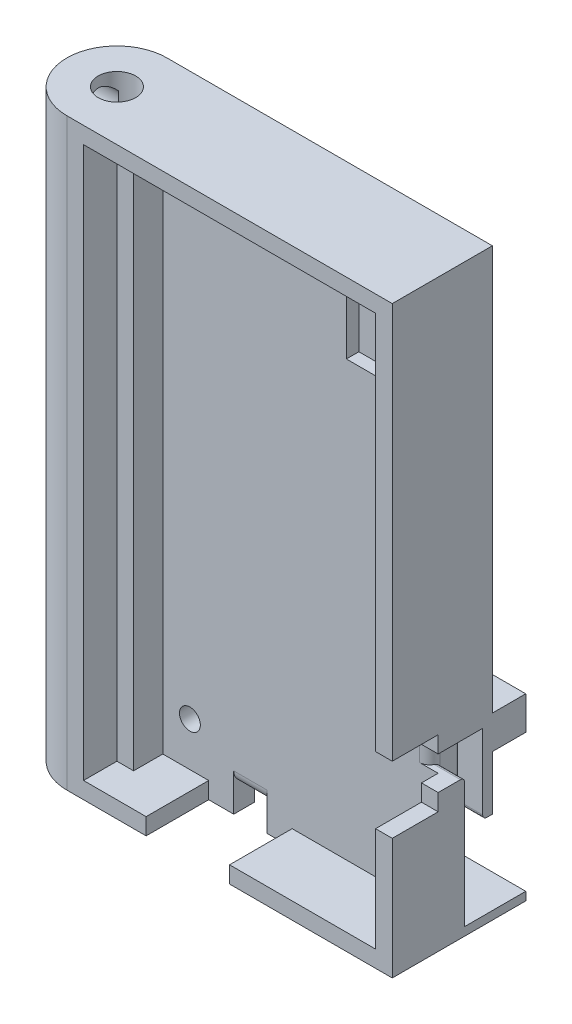
from build123d import *

# Parameters (mm, degrees)
SKETCH1_W                = 39
SKETCH1_H                = 70
BASE_DEPTH               = 4.5
SKETCH2_W                = 4
SKETCH2_H                = 62
WALLS_DEPTH              = 7.5
SKETCH3_W                = 10
SKETCH3_H                = 7.5
PWR_CONNECTOR_HOLE_DEPTH = 4
SKETCH4_W                = 7.5
SKETCH4_H                = 8
GPS_CONNECTOR_HOLE_DEPTH = 4
SKETCH5_R                = 1.25
MOUNTING_HOLES_DEPTH     = 4
GPS_MOUNT_DEPTH          = 4
SKETCH11_W               = 17
SKETCH11_H               = 1
SKETCH11_W_2             = 12
SKETCH11_H_2             = 3
PWR_CABLE_HOLDER1_DEPTH  = 4
SKETCH12_W               = 4
SKETCH12_H               = 2.5
PWR_CABLE_HOLDER2_DEPTH  = 3
PWR_FILLET_R             = 1.5
PWR_FILLET2_R            = 1
PWR_FILLET3_R            = 0.5
GPS_CABLE_HOLDER_DEPTH   = 3
GPS_START                = 1
GPS_FILLET_DEPTH         = 10
GPS_START_2              = 16.5
GPS_FILLET_2_DEPTH       = 4
GPS_START_3              = 9.15727
GPS_FILLET_3_DEPTH       = 8.34273
GPS_FILLET_2_2_R         = 0.5
SKETCH15_R               = 6
BALLON_MOUNT_DEPTH       = 70
SKETCH16_R               = 2.25
BALLOON_MOUNT_HOLE_DEPTH = 70
SKETCH21_R               = 2.25
SAFETY_MOUNT_DEPTH       = 4.5
SKETCH22_W               = 35
SKETCH22_H               = 66
LID_HOLE_DEPTH           = 7.5
SKETCH25_W               = 3.5
SKETCH25_H               = 66
CORRECTION_DEPTH         = 2
SKETCH28_W               = 2
SKETCH28_H               = 2
SMALLER_WALLS_DEPTH      = 2
SKETCH29_W               = 11
SKETCH29_H               = 14
ANTENNA_SPACE_DEPTH      = 1.5


with BuildPart() as part:
    # Sketch1 → Base (new body)
    with BuildSketch(Plane.XY):
        with Locations((19.5, 35)):
            Rectangle(SKETCH1_W, SKETCH1_H)
    extrude(amount=BASE_DEPTH)

    # Sketch2 → Walls (add)
    with BuildSketch(Plane.XY.offset(4.5)):
        Polygon((39, 66), (39, 70), (0, 70), (0, 66), (4, 66), (35, 66), align=None)
        with Locations((37, 35)):
            Rectangle(SKETCH2_W, SKETCH2_H)
        Polygon((4, 66), (0, 66), (0, 0), (4, 0), (4, 4), align=None)
        Polygon((39, 0), (39, 4), (35, 4), (4, 4), (4, 0), align=None)
    extrude(amount=WALLS_DEPTH)

    # Sketch3 → PWR connector hole (cut)
    with BuildSketch(Plane(origin=(0, 4, 0), x_dir=(1, 0, 0), z_dir=(0, 1, 0))):
        with Locations((14.5, -8.25)):
            Rectangle(SKETCH3_W, SKETCH3_H)
    extrude(amount=-PWR_CONNECTOR_HOLE_DEPTH, mode=Mode.SUBTRACT)

    # Sketch4 → GPS connector hole (cut)
    with BuildSketch(Plane.ZY.offset(-35)):
        with Locations((8.25, 18.5)):
            Rectangle(SKETCH4_W, SKETCH4_H)
    extrude(amount=-GPS_CONNECTOR_HOLE_DEPTH, mode=Mode.SUBTRACT)

    # Sketch5 → Mounting holes (cut)
    with BuildSketch(Plane.XY.offset(4.5)):
        with Locations((7.25, 7.25)):
            Circle(SKETCH5_R)
        with Locations(Location((31.75, 7.25, 0), (0, 0, 180))):
            Circle(SKETCH5_R)
        with Locations(Location((7.25, 62.75, 0), (0, 0, 180))):
            Circle(SKETCH5_R)
    extrude(amount=-MOUNTING_HOLES_DEPTH, mode=Mode.SUBTRACT)

    # Sketch7 → GPS mount (add)
    with BuildSketch(Plane(origin=(0, 0, 0), x_dir=(-1, 0, 0), z_dir=(0, 0, -1))):
        Polygon((-39, 1), (-39, 0), (-7, 0), (-7, 18.5), (-39, 18.5), (-39, 17.5), (-8, 17.5), (-8, 1), align=None)
    extrude(amount=GPS_MOUNT_DEPTH)

    # Sketch11 → PWR cable holder1 (add)
    with BuildSketch(Plane(origin=(0, 0, 0), x_dir=(-1, 0, 0), z_dir=(0, 0, -1))):
        Polygon((-5, 0), (-4, 0), (-4, 21.5), (-5, 21.5), (-5, 20.5), align=None)
        with Locations((-13.5, 21)):
            Rectangle(SKETCH11_W, SKETCH11_H)
        with Locations((-33, 20)):
            Rectangle(SKETCH11_W_2, SKETCH11_H_2)
    extrude(amount=PWR_CABLE_HOLDER1_DEPTH)

    # Sketch12 → PWR cable holder2 (cut)
    with BuildSketch(Plane.XZ):
        Polygon((5, 2), (5, 0), (7, 0), (16.5, 0), (16.5, 2), (12.5, 2), align=None)
        with Locations((14.5, 3.25)):
            Rectangle(SKETCH12_W, SKETCH12_H)
    extrude(amount=-PWR_CABLE_HOLDER2_DEPTH, mode=Mode.SUBTRACT)

    # PWR fillet
    pwr_fillet_edges = [part.edges().sort_by_distance(p)[0] for p in [
        (6, 3, 0),
        (14.5, 3, 4.5),
    ]]
    fillet(pwr_fillet_edges, radius=PWR_FILLET_R)

    # PWR fillet2
    pwr_fillet2_edges = [part.edges().sort_by_distance(p)[0] for p in [
        (27, 21.5, -2),
    ]]
    fillet(pwr_fillet2_edges, radius=PWR_FILLET2_R)

    # PWR fillet3
    pwr_fillet3_edges = [part.edges().sort_by_distance(p)[0] for p in [
        (22, 21.5, -2),
        (22, 20.5, -2),
    ]]
    fillet(pwr_fillet3_edges, radius=PWR_FILLET3_R - 0.0001)  # a hair under: the kernel refuses the full size

    # Sketch13 → GPS cable holder (cut)
    with BuildSketch(Plane(origin=(39, 0, 0), x_dir=(0, 0, -1), z_dir=(1, 0, 0))):
        Polygon((-1.156586719, 11), (-2.326586719, 11), (-2.326586719, 1), (0, 1), (0, 11), align=None)
        Polygon((-2.326586719, 11), (-2.326586719, 16.5), (-3.326586719, 16.5), (-3.326586719, 1), (-2.326586719, 1), align=None)
        Polygon((-1.156586719, 20.5), (-2.326586719, 20.5), (-2.326586719, 16.5), (-2.326586719, 11), (-1.156586719, 11), align=None)
        Polygon((-2.326586719, 20.5), (-4.5, 20.5), (-4.5, 16.5), (-3.326586719, 16.5), (-2.326586719, 16.5), align=None)
    extrude(amount=-GPS_CABLE_HOLDER_DEPTH, mode=Mode.SUBTRACT)

    # GPS fillet: read off the stored shape, not the designer's step
    # GPS fillet outline → GPS fillet (cut)
    with BuildSketch(Plane(origin=(0, 0, 0), x_dir=(1, 0, 0), z_dir=(0, 1, 0)).offset(GPS_START)):
        with BuildLine():
            Line((36, -3.326586719), (36, -3.25))
            ThreePointArc((36, -3.25), (35.999412758, -3.288311358), (35.997651584, -3.326586719))
            Line((35.997651584, -3.326586719), (36, -3.326586719))
        make_face()
        with BuildLine():
            Line((36, -1.25), (36, 0))
            Line((36, 0), (34.75, 0))
            ThreePointArc((34.75, 0), (35.633883476, -0.366116524), (36, -1.25))
        make_face()
    extrude(amount=GPS_FILLET_DEPTH, mode=Mode.SUBTRACT)

    # GPS fillet 2 outline → GPS fillet 2 (cut)
    with BuildSketch(Plane(origin=(0, 0, 0), x_dir=(1, 0, 0), z_dir=(0, 1, 0)).offset(GPS_START_2)):
        with BuildLine():
            ThreePointArc((36, -3.25), (35.633883476, -4.133883476), (34.75, -4.5))
            Line((34.75, -4.5), (36, -4.5))
            Line((36, -4.5), (36, -3.25))
        make_face()
        with BuildLine():
            ThreePointArc((35.996504697, -1.156586719), (35.999125868, -1.203260674), (36, -1.25))
            Line((36, -1.25), (36, -1.156586719))
            Line((36, -1.156586719), (35.996504697, -1.156586719))
        make_face()
    extrude(amount=GPS_FILLET_2_DEPTH, mode=Mode.SUBTRACT)

    # GPS fillet 3 outline → GPS fillet 3 (cut)
    with BuildSketch(Plane(origin=(0, 0, 0), x_dir=(1, 0, 0), z_dir=(0, 1, 0)).offset(GPS_START_3)):
        with BuildLine():
            Line((36, -3.326586719), (36, -3.25))
            ThreePointArc((36, -3.25), (35.999412758, -3.288311358), (35.997651584, -3.326586719))
            Line((35.997651584, -3.326586719), (36, -3.326586719))
        make_face()
        with BuildLine():
            ThreePointArc((35.996504697, -1.156586719), (35.999125868, -1.203260674), (36, -1.25))
            Line((36, -1.25), (36, -1.156586719))
            Line((36, -1.156586719), (35.996504697, -1.156586719))
        make_face()
    extrude(amount=GPS_FILLET_3_DEPTH, mode=Mode.SUBTRACT)

    # GPS fillet 2 2
    # the kernel refuses this fillet: 0.5 mm, written as the material it takes off along each edge
    with BuildSketch(Plane(origin=(40.25, 11, 1.156586719), x_dir=(0, 0, -1), z_dir=(-1, 0, 0))) as gps_fillet_2_2_piece_1:
        with BuildLine():
            CenterArc((GPS_FILLET_2_2_R, -GPS_FILLET_2_2_R), GPS_FILLET_2_2_R, 90, 90)
            Line((0, -GPS_FILLET_2_2_R), (0, 0))
            Line((0, 0), (GPS_FILLET_2_2_R, 0))
        make_face()
    extrude(amount=4.25, mode=Mode.SUBTRACT)
    with BuildSketch(Plane(origin=(40.25, 16.5, 3.326586719), x_dir=(0, -1, 0), z_dir=(-1, 0, 0))) as gps_fillet_2_2_piece_2:
        with BuildLine():
            CenterArc((GPS_FILLET_2_2_R, GPS_FILLET_2_2_R), GPS_FILLET_2_2_R, 180, 90)
            Line((0, GPS_FILLET_2_2_R), (0, 0))
            Line((0, 0), (GPS_FILLET_2_2_R, 0))
        make_face()
    extrude(amount=4.25, mode=Mode.SUBTRACT)
    with BuildSketch(Plane(origin=(36, 16.5, 3.326586719), x_dir=(0, -1.0, 5.126796764898245e-10), z_dir=(-1, 0, 0))) as gps_fillet_2_2_piece_3_section:
        with BuildLine():
            CenterArc((GPS_FILLET_2_2_R, GPS_FILLET_2_2_R), GPS_FILLET_2_2_R, 179.999999971, 90)
            Line((GPS_FILLET_2_2_R * 5.12679676753e-10, GPS_FILLET_2_2_R), (0, 0))
            Line((0, 0), (GPS_FILLET_2_2_R, 0))
        make_face()
    gps_fillet_2_2_piece_3 = extrude(amount=1.252348417, mode=Mode.PRIVATE)
    gps_fillet_2_2_piece_3 = gps_fillet_2_2_piece_3 - Plane(origin=(34.749999755, 16.5, 3.249999996), x_dir=(1.0, 0, 2.949740140725451e-09), z_dir=(0, -1, 0)) * Cylinder(1.250000245, 5, mode=Mode.PRIVATE)
    add(gps_fillet_2_2_piece_3, mode=Mode.SUBTRACT)
    with BuildSketch(Plane(origin=(34.746504697, 11, 1.156586719), x_dir=(0, 0, -1), z_dir=(1, 0, 0))) as gps_fillet_2_2_piece_4_section:
        with BuildLine():
            CenterArc((GPS_FILLET_2_2_R, GPS_FILLET_2_2_R), GPS_FILLET_2_2_R, 180, 90)
            Line((-GPS_FILLET_2_2_R * 5.12674791509e-10, GPS_FILLET_2_2_R), (0, 0))
            Line((0, 0), (GPS_FILLET_2_2_R, 0))
        make_face()
    gps_fillet_2_2_piece_4 = extrude(amount=1.253495303, mode=Mode.PRIVATE)
    gps_fillet_2_2_piece_4 = gps_fillet_2_2_piece_4 - Plane(origin=(34.749999998, 11, 1.250000002), x_dir=(1.3197563913171698e-09, 0, -1.0), z_dir=(0, -1, 0)) * Cylinder(1.250000002, 5, mode=Mode.PRIVATE)
    add(gps_fillet_2_2_piece_4, mode=Mode.SUBTRACT)

    # Sketch15 → Ballon mount (add)
    with BuildSketch(Plane.XZ):
        with Locations((0, 6)):
            Circle(SKETCH15_R)
    extrude(amount=-BALLON_MOUNT_DEPTH)

    # Sketch16 → Balloon mount hole (cut)
    with BuildSketch(Plane.XZ):
        with Locations(Location((0, 6, 0), (0, 0, 270))):
            Circle(SKETCH16_R)
    extrude(amount=-BALLOON_MOUNT_HOLE_DEPTH, mode=Mode.SUBTRACT)

    # Sketch21 → Safety mount (cut)
    with BuildSketch(Plane.ZY.offset(6)):
        with Locations((6, 3.5)):
            Circle(SKETCH21_R)
        with Locations((6, 66.5)):
            Circle(SKETCH21_R)
    extrude(amount=-SAFETY_MOUNT_DEPTH, mode=Mode.SUBTRACT)

    # Sketch22 → Lid hole (cut)
    with BuildSketch(Plane.XY.offset(12)):
        with Locations((19.5, 35)):
            Rectangle(SKETCH22_W, SKETCH22_H)
    extrude(amount=-LID_HOLE_DEPTH, mode=Mode.SUBTRACT)

    # Sketch25 → Correction (add)
    with BuildSketch(Plane(origin=(2, 0, 0), x_dir=(0, 0, -1), z_dir=(1, 0, 0))):
        with Locations((-6.25, 35)):
            Rectangle(SKETCH25_W, SKETCH25_H)
    extrude(amount=CORRECTION_DEPTH)

    # Sketch28 → Smaller walls (add)
    with BuildSketch(Plane.XY.offset(4.5)):
        with Locations((38, 21.5)):
            Rectangle(SKETCH28_W, SKETCH28_H)
        with Locations((38, 15.5)):
            Rectangle(SKETCH28_W, SKETCH28_H)
    extrude(amount=SMALLER_WALLS_DEPTH)

    # Sketch29 → Antenna space (cut)
    with BuildSketch(Plane.XY.offset(4.5)):
        with Locations((31.5, 61)):
            Rectangle(SKETCH29_W, SKETCH29_H)
    extrude(amount=-ANTENNA_SPACE_DEPTH, mode=Mode.SUBTRACT)


solid = part.part
